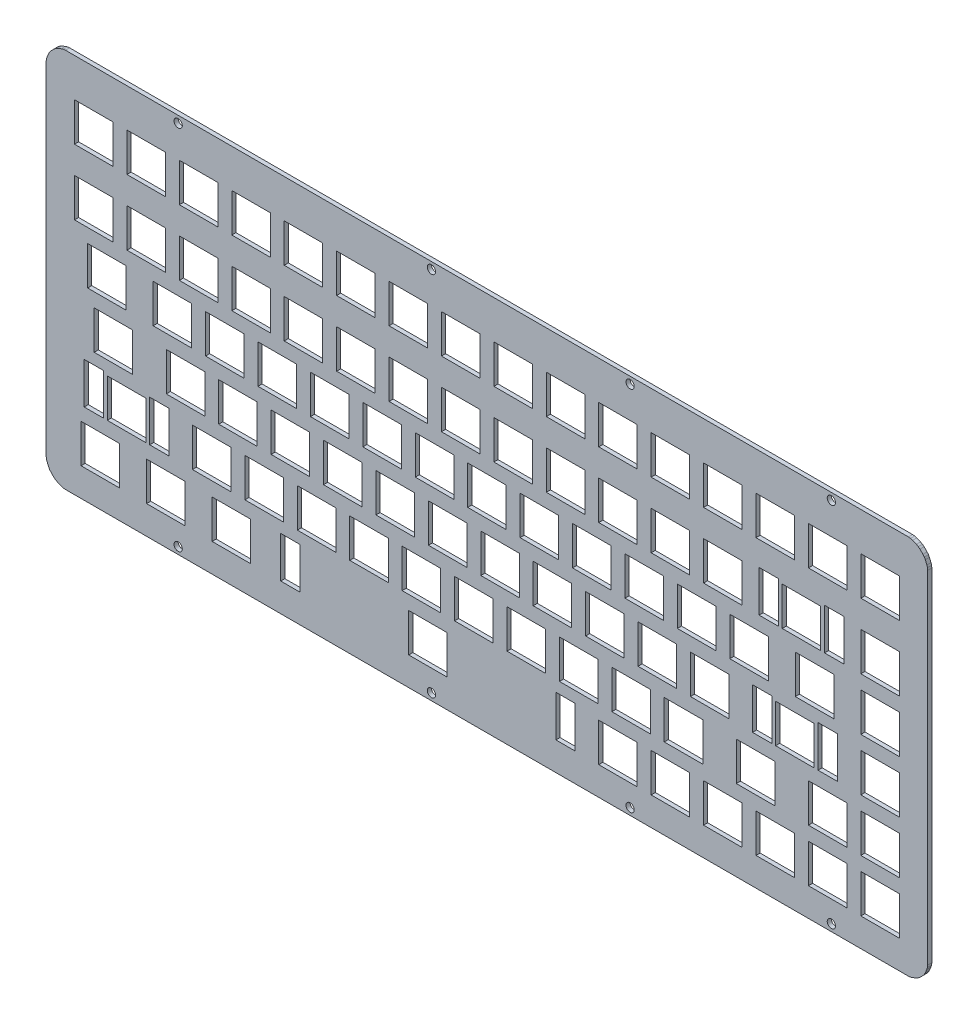
from build123d import *

# Parameters (mm, degrees)
BOSS_EXTRUDE1_DEPTH  = 1.5
SKETCH17_W           = 14
SKETCH17_H           = 14
CUT_EXTRUDE1_DEPTH   = 407.925691159
LPATTERN1_COUNT      = 16
LPATTERN1_PITCH      = 19.05
SKETCH18_W           = 14
SKETCH18_H           = 14
CUT_EXTRUDE2_DEPTH   = 407.925691159
LPATTERN2_COUNT      = 13
LPATTERN2_PITCH      = 19.05
LPATTERN3_COUNT      = 2
LPATTERN3_PITCH      = 257.175
SKETCH20_W           = 14
SKETCH20_H           = 14
CUT_EXTRUDE3_DEPTH   = 407.925691159
SKETCH22_W           = 14
SKETCH22_H           = 14
CUT_EXTRUDE4_DEPTH   = 407.925691159
LPATTERN4_COUNT      = 12
LPATTERN4_PITCH      = 19.05
SKETCH23_W           = 14
SKETCH23_H           = 14
CUT_EXTRUDE5_DEPTH   = 407.925691159
LPATTERN5_COUNT      = 11
LPATTERN5_PITCH      = 19.05
SKETCH24_W           = 14
SKETCH24_H           = 14
CUT_EXTRUDE6_DEPTH   = 407.925691159
LPATTERN6_COUNT      = 10
LPATTERN6_PITCH      = 19.05
SKETCH25_W           = 14
SKETCH25_H           = 14
CUT_EXTRUDE7_DEPTH   = 407.925691159
LPATTERN7_COUNT      = 3
LPATTERN7_PITCH      = 23.8125
SKETCH26_W           = 14
SKETCH26_H           = 14
CUT_EXTRUDE8_DEPTH   = 407.925691159
LPATTERN8_COUNT      = 2
LPATTERN8_PITCH      = 19.05
LPATTERN8_COUNT_DIR2 = 2
LPATTERN8_PITCH_DIR2 = 19.05
SKETCH27_W           = 14
SKETCH27_H           = 14
CUT_EXTRUDE9_DEPTH   = 407.925691159
LPATTERN9_COUNT      = 3
LPATTERN9_PITCH      = 19.05
SKETCH28_W           = 14
SKETCH28_H           = 14
CUT_EXTRUDE10_DEPTH  = 407.925691159
LPATTERN10_COUNT     = 4
LPATTERN10_PITCH     = 19.05
SKETCH29_W           = 14
SKETCH29_H           = 14
CUT_EXTRUDE11_DEPTH  = 407.925691159
LPATTERN11_COUNT     = 2
LPATTERN11_PITCH     = 257.175
SKETCH35_W           = 7
SKETCH35_H           = 15
CUT_EXTRUDE12_DEPTH  = 407.925691159
SKETCH37_W           = 14
SKETCH37_H           = 14
CUT_EXTRUDE13_DEPTH  = 407.925691159
SKETCH38_W           = 14
SKETCH38_H           = 14
CUT_EXTRUDE14_DEPTH  = 407.925691159
SKETCH39_W           = 7
SKETCH39_H           = 15
CUT_EXTRUDE15_DEPTH  = 407.925691159
SKETCH40_W           = 7
SKETCH40_H           = 15
SKETCH40_W_2         = 14
SKETCH40_H_2         = 14
CUT_EXTRUDE16_DEPTH  = 407.925691159
SKETCH41_W           = 14
SKETCH41_H           = 14
CUT_EXTRUDE17_DEPTH  = 407.925691159
SKETCH42_W           = 7
SKETCH42_H           = 15
CUT_EXTRUDE18_DEPTH  = 10
SKETCH45_R           = 1.5
CUT_EXTRUDE19_DEPTH  = 407.925691159


with BuildPart() as part:
    # Sketch14 → Boss-Extrude1 (new body)
    with BuildSketch(Plane.XY):
        Polygon((40.775, -180.54898522), (40.775, -56.30101478), (40.851188161, -55.52747597), (41.076820138, -54.783649753), (41.645421693, -53.41092493), (42.011848702, -52.725376119), (42.50498042, -52.12451), (43.599542346, -51.02994661), (44.200396551, -50.536844495), (44.885896943, -50.170432769), (46.258650676, -49.601819858), (47.00247597, -49.376188161), (47.77601478, -49.3), (354.12398522, -49.3), (354.89752403, -49.376188161), (355.641350247, -49.601820138), (357.01407507, -50.170421693), (357.699623881, -50.536848702), (358.30049, -51.02998042), (359.39505339, -52.124542346), (359.888155505, -52.725396551), (360.254566776, -53.410896093), (360.823178729, -54.783646018), (361.048811839, -55.52747597), (361.125, -56.30101478), (361.125, -180.54898522), (361.048811839, -181.32252403), (360.823180142, -182.066349324), (360.254567231, -183.439103057), (359.888155505, -184.124603449), (359.39505339, -184.725457654), (358.30049, -185.82001958), (357.699623881, -186.313151298), (357.01407507, -186.679578307), (355.641350247, -187.248179862), (354.89752403, -187.473811839), (354.12398522, -187.55), (47.77601478, -187.55), (47.00247597, -187.473811839), (46.258650676, -187.248180142), (44.885896943, -186.679567231), (44.200396551, -186.313155505), (43.599542346, -185.82005339), (42.50498042, -184.72549), (42.011848702, -184.124623881), (41.645421693, -183.43907507), (41.076820138, -182.066350247), (40.851188161, -181.32252403), align=None)
    extrude(amount=BOSS_EXTRUDE1_DEPTH)

    # Sketch17 → Cut-Extrude1 (cut, through all)
    with BuildSketch(Plane.XY.offset(1.5)):
        with Locations((58.072891709, -70.2375)):
            Rectangle(SKETCH17_W, SKETCH17_H)
    cut_extrude1 = extrude(amount=-CUT_EXTRUDE1_DEPTH, mode=Mode.SUBTRACT)

    # LPattern1: Cut-Extrude1 ×16
    with Locations(*[(i * LPATTERN1_PITCH, 0, 0) for i in range(1, LPATTERN1_COUNT)]):
        add(cut_extrude1, mode=Mode.SUBTRACT)

    # Sketch18 → Cut-Extrude2 (cut, through all)
    with BuildSketch(Plane.XY.offset(1.5)):
        with Locations((58.073441718, -94.051507519)):
            Rectangle(SKETCH18_W, SKETCH18_H)
    cut_extrude2 = extrude(amount=-CUT_EXTRUDE2_DEPTH, mode=Mode.SUBTRACT)

    # LPattern2: Cut-Extrude2 ×13
    with Locations(*[(i * LPATTERN2_PITCH, 0, 0) for i in range(1, LPATTERN2_COUNT)]):
        add(cut_extrude2, mode=Mode.SUBTRACT)

    # LPattern3: Cut-Extrude2 ×2
    with Locations(*[(i * LPATTERN3_PITCH, 0, 0) for i in range(1, LPATTERN3_COUNT)]):
        add(cut_extrude2, mode=Mode.SUBTRACT)

    # Sketch20 → Cut-Extrude3 (cut, through all)
    with BuildSketch(Plane.XY.offset(1.5)):
        with Locations((62.831674868, -113.106226091)):
            Rectangle(SKETCH20_W, SKETCH20_H)
    cut_extrude3 = extrude(amount=-CUT_EXTRUDE3_DEPTH, mode=Mode.SUBTRACT)

    # Sketch22 → Cut-Extrude4 (cut, through all)
    with BuildSketch(Plane.XY.offset(1.5)):
        with Locations((86.65, -113.1)):
            Rectangle(SKETCH22_W, SKETCH22_H)
    cut_extrude4 = extrude(amount=-CUT_EXTRUDE4_DEPTH, mode=Mode.SUBTRACT)

    # LPattern4: Cut-Extrude4 ×12
    with Locations(*[(i * LPATTERN4_PITCH, 0, 0) for i in range(1, LPATTERN4_COUNT)]):
        add(cut_extrude4, mode=Mode.SUBTRACT)

    # Sketch23 → Cut-Extrude5 (cut, through all)
    with BuildSketch(Plane.XY.offset(1.5)):
        with Locations((91.4125, -132.15)):
            Rectangle(SKETCH23_W, SKETCH23_H)
    cut_extrude5 = extrude(amount=-CUT_EXTRUDE5_DEPTH, mode=Mode.SUBTRACT)

    # LPattern5: Cut-Extrude5 ×11
    with Locations(*[(i * LPATTERN5_PITCH, 0, 0) for i in range(1, LPATTERN5_COUNT)]):
        add(cut_extrude5, mode=Mode.SUBTRACT)

    # Sketch24 → Cut-Extrude6 (cut, through all)
    with BuildSketch(Plane.XY.offset(1.5)):
        with Locations((100.9375, -151.2)):
            Rectangle(SKETCH24_W, SKETCH24_H)
    cut_extrude6 = extrude(amount=-CUT_EXTRUDE6_DEPTH, mode=Mode.SUBTRACT)

    # LPattern6: Cut-Extrude6 ×10
    with Locations(*[(i * LPATTERN6_PITCH, 0, 0) for i in range(1, LPATTERN6_COUNT)]):
        add(cut_extrude6, mode=Mode.SUBTRACT)

    # Sketch25 → Cut-Extrude7 (cut, through all)
    with BuildSketch(Plane.XY.offset(1.5)):
        with Locations((60.45625, -170.25)):
            Rectangle(SKETCH25_W, SKETCH25_H)
    cut_extrude7 = extrude(amount=-CUT_EXTRUDE7_DEPTH, mode=Mode.SUBTRACT)

    # LPattern7: Cut-Extrude7 ×3
    with Locations(*[(i * LPATTERN7_PITCH, 0, 0) for i in range(1, LPATTERN7_COUNT)]):
        add(cut_extrude7, mode=Mode.SUBTRACT)

    # Sketch26 → Cut-Extrude8 (cut, through all)
    with BuildSketch(Plane.XY.offset(1.5)):
        with Locations((324.775, -151.2)):
            Rectangle(SKETCH26_W, SKETCH26_H)
    cut_extrude8 = extrude(amount=-CUT_EXTRUDE8_DEPTH, mode=Mode.SUBTRACT)

    # LPattern8: Cut-Extrude8 2 × 2
    with Locations(*[(i * LPATTERN8_PITCH, -j * LPATTERN8_PITCH_DIR2, 0) for i in range(LPATTERN8_COUNT) for j in range(LPATTERN8_COUNT_DIR2) if (i, j) != (0, 0)]):
        add(cut_extrude8, mode=Mode.SUBTRACT)

    # Sketch27 → Cut-Extrude9 (cut, through all)
    with BuildSketch(Plane.XY.offset(1.5)):
        with Locations((343.825, -94.05)):
            Rectangle(SKETCH27_W, SKETCH27_H)
    cut_extrude9 = extrude(amount=-CUT_EXTRUDE9_DEPTH, mode=Mode.SUBTRACT)

    # LPattern9: Cut-Extrude9 ×3
    with Locations(*[(0, -i * LPATTERN9_PITCH, 0) for i in range(1, LPATTERN9_COUNT)]):
        add(cut_extrude9, mode=Mode.SUBTRACT)

    # Sketch28 → Cut-Extrude10 (cut, through all)
    with BuildSketch(Plane.XY.offset(1.5)):
        with Locations((248.575, -170.25)):
            Rectangle(SKETCH28_W, SKETCH28_H)
    cut_extrude10 = extrude(amount=-CUT_EXTRUDE10_DEPTH, mode=Mode.SUBTRACT)

    # LPattern10: Cut-Extrude10 ×4
    with Locations(*[(i * LPATTERN10_PITCH, 0, 0) for i in range(1, LPATTERN10_COUNT)]):
        add(cut_extrude10, mode=Mode.SUBTRACT)

    # Sketch29 → Cut-Extrude11 (cut, through all)
    with BuildSketch(Plane.XY.offset(1.5)):
        with Locations((179.51875, -170.25)):
            Rectangle(SKETCH29_W, SKETCH29_H)
    extrude(amount=-CUT_EXTRUDE11_DEPTH, mode=Mode.SUBTRACT)

    # LPattern11: Cut-Extrude3 ×2
    with Locations(*[(i * LPATTERN11_PITCH, 0, 0) for i in range(1, LPATTERN11_COUNT)]):
        add(cut_extrude3, mode=Mode.SUBTRACT)

    # Sketch35 → Cut-Extrude12 (cut, through all)
    with BuildSketch(Plane.XY.offset(1.5)):
        with Locations((129.51875, -169.75)):
            Rectangle(SKETCH35_W, SKETCH35_H)
        with Locations((229.51875, -169.75)):
            Rectangle(SKETCH35_W, SKETCH35_H)
    extrude(amount=-CUT_EXTRUDE12_DEPTH, mode=Mode.SUBTRACT)

    # Sketch37 → Cut-Extrude13 (cut, through all)
    with BuildSketch(Plane.XY.offset(1.5)):
        with Locations((65.21875, -132.15)):
            Rectangle(SKETCH37_W, SKETCH37_H)
    extrude(amount=-CUT_EXTRUDE13_DEPTH, mode=Mode.SUBTRACT)

    # Sketch38 → Cut-Extrude14 (cut, through all)
    with BuildSketch(Plane.XY.offset(1.5)):
        with Locations((69.98125, -151.2)):
            Rectangle(SKETCH38_W, SKETCH38_H)
    extrude(amount=-CUT_EXTRUDE14_DEPTH, mode=Mode.SUBTRACT)

    # Sketch39 → Cut-Extrude15 (cut, through all)
    with BuildSketch(Plane.XY.offset(1.5)):
        with Locations((81.88125, -150.6894482)):
            Rectangle(SKETCH39_W, SKETCH39_H)
        with Locations((58.08125, -150.6894482)):
            Rectangle(SKETCH39_W, SKETCH39_H)
    extrude(amount=-CUT_EXTRUDE15_DEPTH, mode=Mode.SUBTRACT)

    # Sketch40 → Cut-Extrude16 (cut, through all)
    with BuildSketch(Plane.XY.offset(1.5)):
        with Locations((324.76875, -131.65)):
            Rectangle(SKETCH40_W, SKETCH40_H)
        with Locations((312.86875, -132.15)):
            Rectangle(SKETCH40_W_2, SKETCH40_H_2)
        with Locations((300.96875, -131.65)):
            Rectangle(SKETCH40_W, SKETCH40_H)
    extrude(amount=-CUT_EXTRUDE16_DEPTH, mode=Mode.SUBTRACT)

    # Sketch41 → Cut-Extrude17 (cut, through all)
    with BuildSketch(Plane.XY.offset(1.5)):
        with Locations((298.58125, -151.2)):
            Rectangle(SKETCH41_W, SKETCH41_H)
    extrude(amount=-CUT_EXTRUDE17_DEPTH, mode=Mode.SUBTRACT)

    # Sketch42 → Cut-Extrude18 (cut)
    with BuildSketch(Plane.XY.offset(1.5)):
        with Locations((327.148441718, -93.551507519)):
            Rectangle(SKETCH42_W, SKETCH42_H)
        with Locations((303.348441718, -93.551507519)):
            Rectangle(SKETCH42_W, SKETCH42_H)
    extrude(amount=-CUT_EXTRUDE18_DEPTH, mode=Mode.SUBTRACT)

    # Sketch45 → Cut-Extrude19 (cut, through all)
    with BuildSketch(Plane.XY.offset(1.5)):
        with Locations((88.741042098, -51.807705648)):
            Circle(SKETCH45_R)
        with Locations((88.741042098, -185.05)):
            Circle(SKETCH45_R)
        with Locations((180.785949113, -51.8)):
            Circle(SKETCH45_R)
        with Locations((180.785949113, -185.05)):
            Circle(SKETCH45_R)
        with Locations((252.982947327, -185.05)):
            Circle(SKETCH45_R)
        with Locations((252.982947327, -51.8)):
            Circle(SKETCH45_R)
        with Locations((326.117568895, -51.8)):
            Circle(SKETCH45_R)
        with Locations((326.117568895, -185.05)):
            Circle(SKETCH45_R)
    extrude(amount=-CUT_EXTRUDE19_DEPTH, mode=Mode.SUBTRACT)


solid = part.part
